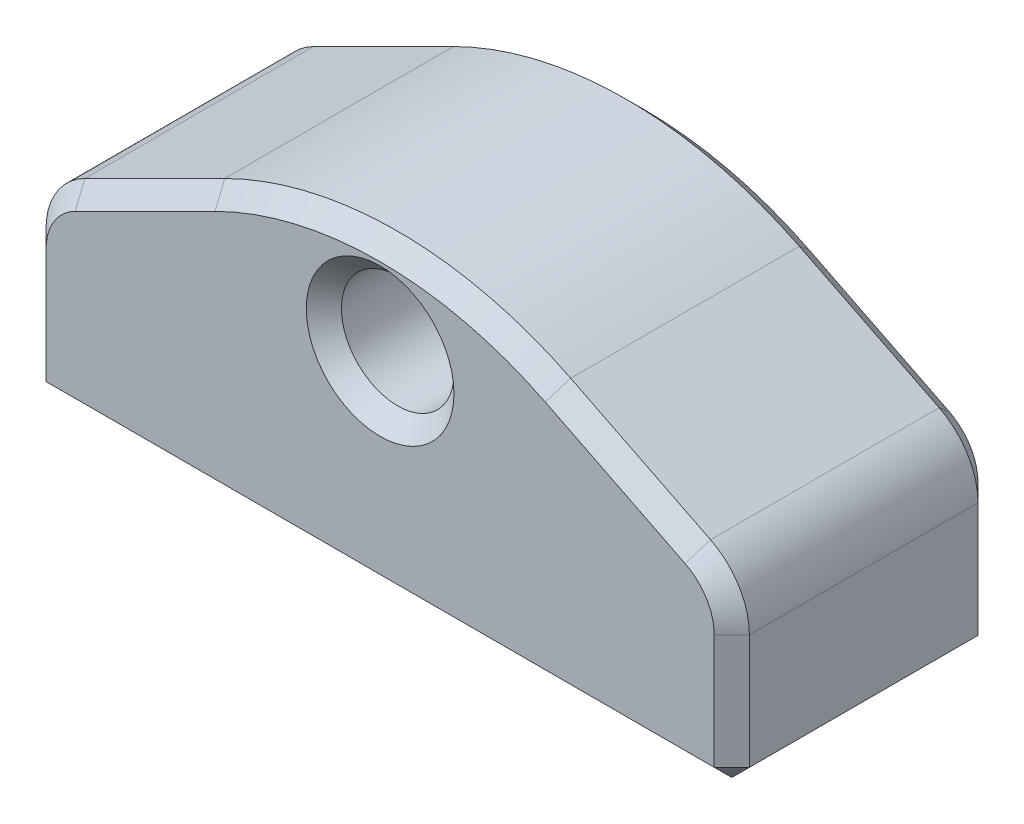
from build123d import *

# Parameters (mm, degrees)
SKETCH1_W           = 25.4
SKETCH1_H           = 9.525
BOSS_EXTRUDE1_DEPTH = 12.7
SKETCH1_3_R         = 2.032
CUT_EXTRUDE1_DEPTH  = 4.7625
SKETCH3_R           = 2.032
CUT_EXTRUDE2_DEPTH  = 21.329919454
FILLET1_R           = 13.97
FILLET2_R           = 2.54
CHAMFER1_SIZE       = 0.635
CHAMFER2_SIZE       = 0.635
CHAMFER3_SIZE       = 0.635


with BuildPart() as part:
    # Sketch1 → Boss-Extrude1 (new body)
    with BuildSketch(Plane(origin=(0, 0, 0), x_dir=(1, 0, 0), z_dir=(0, 1, 0))):
        Rectangle(SKETCH1_W, SKETCH1_H)
    extrude(amount=BOSS_EXTRUDE1_DEPTH)

    # Sketch1<3> → Cut-Extrude1 (cut)
    with BuildSketch(Plane(origin=(0, 0, 0), x_dir=(1, 0, 0), z_dir=(0, 1, 0))):
        with Locations((-6.35, 0)):
            Circle(SKETCH1_3_R)
        with Locations((6.35, 0)):
            Circle(SKETCH1_3_R)
    extrude(amount=CUT_EXTRUDE1_DEPTH, mode=Mode.SUBTRACT)

    # Sketch3 → Cut-Extrude2 (cut, through all)
    with BuildSketch(Plane.XY.offset(4.7625)):
        Polygon((-12.7, 12.7), (-12.7, 6.35), (0, 12.7), align=None)
        Polygon((12.7, 12.7), (0, 12.7), (12.7, 6.35), align=None)
        with Locations((0, 7.62)):
            Circle(SKETCH3_R)
    extrude(amount=-CUT_EXTRUDE2_DEPTH, mode=Mode.SUBTRACT)

    # Fillet1
    fillet1_edges = [part.edges().sort_by_distance(p)[0] for p in [
        (0, 12.7, 0),
    ]]
    fillet(fillet1_edges, radius=FILLET1_R)

    # Fillet2
    fillet2_edges = [part.edges().sort_by_distance(p)[0] for p in [
        (12.7, 6.35, 0),
        (-12.7, 6.35, 0),
    ]]
    fillet(fillet2_edges, radius=FILLET2_R)

    # Chamfer1
    chamfer1_edges = [part.edges().sort_by_distance(p)[0] for p in [
        (-2.032, 7.62, 4.7625),
        (-2.032, 7.62, -4.7625),
    ]]
    chamfer(chamfer1_edges, length=CHAMFER1_SIZE)

    # Chamfer2
    chamfer2_edges = [part.edges().sort_by_distance(p)[0] for p in [
        (4.318, 0, 0),
        (-8.382, 0, 0),
    ]]
    chamfer(chamfer2_edges, length=CHAMFER2_SIZE)

    # Chamfer3
    chamfer3_edges = [part.edges().sort_by_distance(p)[0] for p in [
        (-12.7, 2.390096834, 4.7625),
        (-12.320653053, 6.115550693, 4.7625),
        (-8.771748231, 8.314125885, 4.7625),
        (12.7, 2.390096834, 4.7625),
        (0, 11.051065177, 4.7625),
        (12.320653053, 6.115550693, 4.7625),
        (8.771748231, 8.314125885, 4.7625),
        (12.7, 2.390096834, -4.7625),
        (12.320653053, 6.115550693, -4.7625),
        (8.771748231, 8.314125885, -4.7625),
        (0, 11.051065177, -4.7625),
        (-8.771748231, 8.314125885, -4.7625),
        (-12.320653053, 6.115550693, -4.7625),
        (-12.7, 2.390096834, -4.7625),
        (12.7, 0, 0),
        (0, 0, -4.7625),
        (0, 0, 4.7625),
        (-12.7, 0, 0),
    ]]
    chamfer(chamfer3_edges, length=CHAMFER3_SIZE)


solid = part.part
